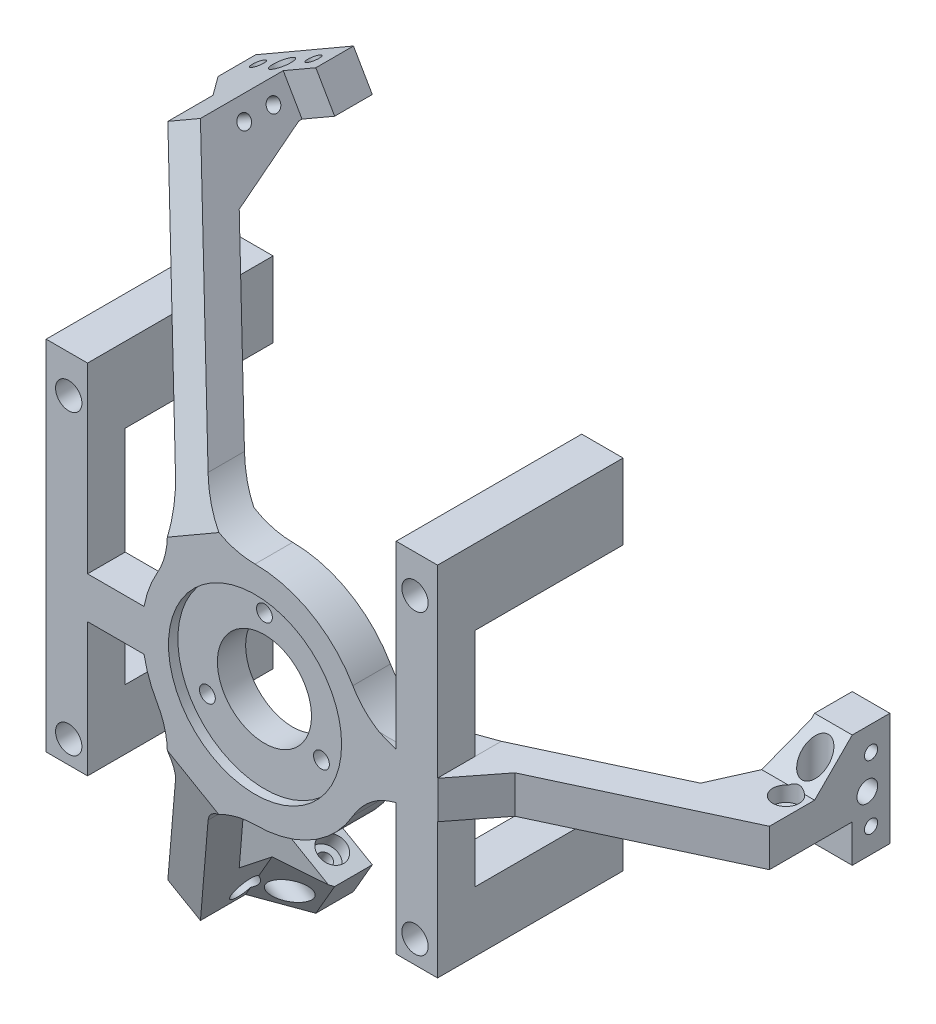
from build123d import *
from OCP.BRepFilletAPI import BRepFilletAPI_MakeChamfer

# Parameters (mm, degrees)
ESQUISSE1_W                    = 10
ESQUISSE1_H                    = 30
BOSS_EXTRU_1_DEPTH             = 10
BOSS_EXTRU_1_2_DEPTH           = 10
BOSS_EXTRU_1_3_DEPTH           = 10
ESQUISSE2_W                    = 10
ESQUISSE2_H                    = 10
BOSS_EXTRU_2_DEPTH             = 45
BOSS_EXTRU_3_DEPTH             = 10
CHANFREIN1_SIZE                = 28
CHANFREIN1_SIZE2               = 60.046193774
CHANFREIN2_SIZE                = 33
CHANFREIN2_SIZE2               = 70.768728377
CONG_1_R                       = 20
CHANFREIN3_SIZE                = 10
CHANFREIN3_SIZE2               = 16.129823564
ENL_V_MAT_EXTRU_1_REACH        = 158.32
ESQUISSE4_R                    = 12.5
ESQUISSE5_R                    = 23
ENL_V_MAT_EXTRU_2_DEPTH        = 2.5
ENL_V_MAT_EXTRU_3_REACH        = 157.297
ESQUISSE6_R                    = 2.1
ESQUISSE7_W                    = 11
ESQUISSE7_H                    = 95
BOSS_EXTRU_4_DEPTH             = 39.3
BOSS_EXTRU_4_DIRECTION_2_REACH = 154.434
ENL_V_MAT_EXTRU_4_REACH        = 152.471
ESQUISSE8_R                    = 1.75
ESQUISSE9_R                    = 3.5
ENL_V_MAT_EXTRU_5_DEPTH        = 28.3
ESQUISSE10_W                   = 26.008475794
ESQUISSE10_H                   = 59
ESQUISSE10_W_2                 = 11
ENL_V_MAT_EXTRU_6_DEPTH        = 39.3
BOSS_EXTRU_5_REACH             = 154.434
BOSS_EXTRU_6_REACH             = 153.518
CHANFREIN5_SIZE                = 10
CHANFREIN5_SIZE_2              = 7.374028065
ENL_V_MAT_EXTRU_7_REACH        = 157.079
ESQUISSE11_R                   = 1.75
ESQUISSE12_R                   = 3.5
ENL_V_MAT_EXTRU_8_DEPTH        = 4
ENL_V_MAT_EXTRU_9_REACH        = 244.289
ESQUISSE13_R                   = 1.75
ESQUISSE14_R                   = 3.5
ENL_V_MAT_EXTRU_10_DEPTH       = 4
ENL_V_MAT_EXTRU_11_REACH       = 244.289
ESQUISSE15_R                   = 2.75
R_P_TITION_CIRCULAIRE1_COUNT   = 3
CHANFREIN4_SIZE                = 10


with BuildPart() as part:
    # Esquisse1 → Boss.-Extru.1 (new body)
    with BuildSketch(Plane.XY):
        with Locations((98.67, 0)):
            Rectangle(ESQUISSE1_W, ESQUISSE1_H)
    extrude(amount=BOSS_EXTRU_1_DEPTH)



with BuildPart() as body_2:
    # Esquisse1 → Boss.-Extru.1 2 (new body)
    with BuildSketch(Plane.XY):
        Polygon((-33.844618943, -88.620599572), (-59.825381057, -73.620599572), (-64.825381057, -82.28085361), (-38.844618943, -97.28085361), align=None)
    extrude(amount=BOSS_EXTRU_1_2_DEPTH)


with BuildPart() as body_3:
    # Esquisse1 → Boss.-Extru.1 3 (new body)
    with BuildSketch(Plane.XY):
        Polygon((-59.825381057, 73.620599572), (-33.844618943, 88.620599572), (-38.844618943, 97.28085361), (-64.825381057, 82.28085361), align=None)
    extrude(amount=BOSS_EXTRU_1_3_DEPTH)


with BuildPart() as part_1:
    add(part.part)

    add(body_2.part)  # Boss.-Extru.2 merges body 2

    add(body_3.part)  # Boss.-Extru.2 merges body 3
    # Esquisse2 → Boss.-Extru.2 (add)
    with BuildSketch(Plane.XY.offset(10)):
        Polygon((-47.504872981, 92.28085361), (-56.165127019, 87.28085361), (-51.165127019, 78.620599572), (-42.504872981, 83.620599572), align=None)
        with Locations((98.67, 0)):
            Rectangle(ESQUISSE2_W, ESQUISSE2_H)
        Polygon((-42.504872981, -83.620599572), (-51.165127019, -78.620599572), (-56.165127019, -87.28085361), (-47.504872981, -92.28085361), align=None)
    extrude(amount=BOSS_EXTRU_2_DEPTH)

    # Esquisse3 → Boss.-Extru.3 (add)
    with BuildSketch(Plane.XY.offset(55)):
        with BuildLine():
            Line((103.67, 5), (103.67, -5))
            Line((103.67, -5), (29.580398915, -5))
            ThreePointArc((29.580398915, -5), (15, -25.980762114), (-10.460072439, -28.117376915))
            Line((-10.460072439, -28.117376915), (-47.504872981, -92.28085361))
            Line((-47.504872981, -92.28085361), (-56.165127019, -87.28085361))
            Line((-56.165127019, -87.28085361), (-19.120326477, -23.117376915))
            ThreePointArc((-19.120326477, -23.117376915), (-30, 0), (-19.120326477, 23.117376915))
            Line((-19.120326477, 23.117376915), (-56.165127019, 87.28085361))
            Line((-56.165127019, 87.28085361), (-47.504872981, 92.28085361))
            Line((-47.504872981, 92.28085361), (-10.460072439, 28.117376915))
            ThreePointArc((-10.460072439, 28.117376915), (15, 25.980762114), (29.580398915, 5))
            Line((29.580398915, 5), (103.67, 5))
        make_face()
    extrude(amount=BOSS_EXTRU_3_DEPTH)

    # Chanfrein1: one chamfer whose edges measure the first distance from different faces: ONE call of the kernel's chamfer builder (chamfer() names one face for all edges)
    chanfrein1_edges_1 = [part_1.edges().sort_by_distance(p)[0] for p in [
        (93.67, 0, 55),
    ]]
    chanfrein1_side_1 = [part_1.faces().sort_by_distance(p)[0] for p in [
        (93.67, 0, 21.5),
    ]]
    chanfrein1_edges_2 = [part_1.edges().sort_by_distance(p)[0] for p in [
        (-46.835, -81.120599572, 55),
    ]]
    chanfrein1_side_2 = [part_1.faces().sort_by_distance(p)[0] for p in [
        (-46.835, -81.120599572, 21.5),
    ]]
    chanfrein1_edges_3 = [part_1.edges().sort_by_distance(p)[0] for p in [
        (-46.835, 81.120599572, 55),
    ]]
    chanfrein1_side_3 = [part_1.faces().sort_by_distance(p)[0] for p in [
        (-46.835, 81.120599572, 21.5),
    ]]
    chanfrein1 = BRepFilletAPI_MakeChamfer(part_1.part.solid().wrapped)
    for e in chanfrein1_edges_1:
        chanfrein1.Add(CHANFREIN1_SIZE, CHANFREIN1_SIZE2, e.wrapped, chanfrein1_side_1[0].wrapped)  # the first distance lies on this face
    for e in chanfrein1_edges_2:
        chanfrein1.Add(CHANFREIN1_SIZE, CHANFREIN1_SIZE2, e.wrapped, chanfrein1_side_2[0].wrapped)  # the first distance lies on this face
    for e in chanfrein1_edges_3:
        chanfrein1.Add(CHANFREIN1_SIZE, CHANFREIN1_SIZE2, e.wrapped, chanfrein1_side_3[0].wrapped)  # the first distance lies on this face
    add(Compound.cast(chanfrein1.Shape()), mode=Mode.REPLACE)

    # Chanfrein2: one chamfer whose edges measure the first distance from different faces: ONE call of the kernel's chamfer builder (chamfer() names one face for all edges)
    chanfrein2_edges_1 = [part_1.edges().sort_by_distance(p)[0] for p in [
        (-51.835, 89.78085361, 65),
    ]]
    chanfrein2_side_1 = [part_1.faces().sort_by_distance(p)[0] for p in [
        (-51.835, 89.78085361, 26.029411765),
    ]]
    chanfrein2_edges_2 = [part_1.edges().sort_by_distance(p)[0] for p in [
        (-51.835, -89.78085361, 65),
    ]]
    chanfrein2_side_2 = [part_1.faces().sort_by_distance(p)[0] for p in [
        (-51.835, -89.78085361, 26.029411765),
    ]]
    chanfrein2_edges_3 = [part_1.edges().sort_by_distance(p)[0] for p in [
        (103.67, 0, 65),
    ]]
    chanfrein2_side_3 = [part_1.faces().sort_by_distance(p)[0] for p in [
        (103.67, 0, 26.029411765),
    ]]
    chanfrein2 = BRepFilletAPI_MakeChamfer(part_1.part.solid().wrapped)
    for e in chanfrein2_edges_1:
        chanfrein2.Add(CHANFREIN2_SIZE, CHANFREIN2_SIZE2, e.wrapped, chanfrein2_side_1[0].wrapped)  # the first distance lies on this face
    for e in chanfrein2_edges_2:
        chanfrein2.Add(CHANFREIN2_SIZE, CHANFREIN2_SIZE2, e.wrapped, chanfrein2_side_2[0].wrapped)  # the first distance lies on this face
    for e in chanfrein2_edges_3:
        chanfrein2.Add(CHANFREIN2_SIZE, CHANFREIN2_SIZE2, e.wrapped, chanfrein2_side_3[0].wrapped)  # the first distance lies on this face
    add(Compound.cast(chanfrein2.Shape()), mode=Mode.REPLACE)

    # Congé1
    # the kernel refuses this fillet: 20 mm, written as the material it adds along each edge
    with BuildSketch(Plane(origin=(29.580398915, -5, 55), x_dir=(1, 0, 0), z_dir=(0, 0, 1))) as cong_1_piece_1_section:
        with BuildLine():
            CenterArc((13.720871274, -20), CONG_1_R, 90, 60)
            ThreePointArc((-3.599636802, -10), (-1.353449847, -5.160676467), (0, 0))
            Line((0, 0), (13.720871274, 0))
        make_face()
    cong_1_piece_1 = extrude(amount=10, mode=Mode.PRIVATE)
    cong_1_piece_1 = split(cong_1_piece_1, bisect_by=Plane(origin=(29.686956687, -8.874488786, 56.835783089), z_dir=(-0.42261826174069717, 0, -0.9063077870366512)), keep=Keep.TOP, mode=Mode.PRIVATE)
    add(cong_1_piece_1)
    with BuildSketch(Plane(origin=(29.580398915, -5, 20.697821816), x_dir=(1, 0, 0), z_dir=(0, 0, 1))) as cong_1_piece_2_section:
        with BuildLine():
            CenterArc((13.720871274, -20), CONG_1_R, 90, 60)
            ThreePointArc((-3.599636802, -10), (-1.353449847, -5.160676467), (0, 0))
            Line((0, 0), (13.720871274, 0))
        make_face()
    cong_1_piece_2 = extrude(amount=44.302178184, mode=Mode.PRIVATE)
    cong_1_piece_2 = split(cong_1_piece_2, bisect_by=Plane(origin=(38.771114589, -5.14420789, 55), z_dir=(0, 0, -1)), keep=Keep.TOP, mode=Mode.PRIVATE)
    cong_1_piece_2 = split(cong_1_piece_2, bisect_by=Plane(origin=(38.311444008, -5.14420789, 52.814118603), z_dir=(0.42261826174069717, 0, 0.9063077870366512)), keep=Keep.TOP, mode=Mode.PRIVATE)
    add(cong_1_piece_2)
    with BuildSketch(Plane(origin=(29.580398915, -5, 55), x_dir=(1, 0, 0), z_dir=(0, 0, 1))) as cong_1_piece_3_section:
        with BuildLine():
            CenterArc((13.720871274, -20), CONG_1_R, 90, 60)
            ThreePointArc((-3.599636802, -10), (-1.353449847, -5.160676467), (0, 0))
            Line((0, 0), (13.720871274, 0))
        make_face()
    cong_1_piece_3 = extrude(amount=10, mode=Mode.PRIVATE)
    cong_1_piece_3 = split(cong_1_piece_3, bisect_by=Plane(origin=(34.156961746, -7.089474208, 64.41446208), z_dir=(-0.42261826174069717, 0, -0.906307787036651)), keep=Keep.TOP, mode=Mode.PRIVATE)
    cong_1_piece_3 = split(cong_1_piece_3, bisect_by=Plane(origin=(30.455788686, -7.089474208, 56.47727084), z_dir=(0.42261826174069717, 0, 0.9063077870366512)), keep=Keep.TOP, mode=Mode.PRIVATE)
    add(cong_1_piece_3)
    with BuildSketch(Plane(origin=(-10.460072439, -28.117376915, 20.697821816), x_dir=(0.984186439950099, -0.17713568646196043, 0), z_dir=(0, 0, 1))) as cong_1_piece_4_section:
        with BuildLine():
            CenterArc((14.170854917, -19.683728799), CONG_1_R, 100.202965887, 60)
            Line((-4.647111129, -12.909944487), (0, 0))
            ThreePointArc((0, 0), (5.314070594, -0.474406801), (10.628141188, 0))
        make_face()
    cong_1_piece_4 = extrude(amount=44.302178184, mode=Mode.PRIVATE)
    cong_1_piece_4 = split(cong_1_piece_4, bisect_by=Plane(origin=(-14.930542581, -36.148874113, 55), z_dir=(0, 0, -1)), keep=Keep.TOP, mode=Mode.PRIVATE)
    cong_1_piece_4 = split(cong_1_piece_4, bisect_by=Plane(origin=(-14.700707291, -35.750787713, 52.814118603), z_dir=(-0.21130913087034803, -0.3659981507706655, 0.906307787036651)), keep=Keep.TOP, mode=Mode.PRIVATE)
    add(cong_1_piece_4)
    with BuildSketch(Plane(origin=(-10.460072439, -28.117376915, 55), x_dir=(0.9841864399500992, -0.17713568646195998, 0), z_dir=(0, 0, 1))) as cong_1_piece_5_section:
        with BuildLine():
            CenterArc((14.170854917, -19.683728799), CONG_1_R, 100.202965887, 60)
            Line((-4.647111129, -12.909944487), (0, 0))
            ThreePointArc((0, 0), (5.314070594, -0.474406801), (10.628141188, 0))
        make_face()
    cong_1_piece_5 = extrude(amount=10, mode=Mode.PRIVATE)
    cong_1_piece_5 = split(cong_1_piece_5, bisect_by=Plane(origin=(-7.157945608, -30.146903047, 56.835783088), z_dir=(0.21130913087034803, 0.3659981507706655, -0.906307787036651)), keep=Keep.TOP, mode=Mode.PRIVATE)
    add(cong_1_piece_5)
    with BuildSketch(Plane(origin=(-10.460072439, -28.117376915, 55), x_dir=(0.9841864399500992, -0.17713568646195998, 0), z_dir=(0, 0, 1))) as cong_1_piece_6_section:
        with BuildLine():
            CenterArc((14.170854917, -19.683728799), CONG_1_R, 100.202965887, 60)
            Line((-4.647111129, -12.909944487), (0, 0))
            ThreePointArc((0, 0), (5.314070594, -0.474406801), (10.628141188, 0))
        make_face()
    cong_1_piece_6 = extrude(amount=10, mode=Mode.PRIVATE)
    cong_1_piece_6 = split(cong_1_piece_6, bisect_by=Plane(origin=(-10.938816109, -33.125533693, 64.414462079), z_dir=(0.21130913087034933, 0.3659981507706645, -0.906307787036651)), keep=Keep.TOP, mode=Mode.PRIVATE)
    cong_1_piece_6 = split(cong_1_piece_6, bisect_by=Plane(origin=(-9.088229579, -29.9202238, 56.477270839), z_dir=(-0.21130913087034803, -0.3659981507706655, 0.906307787036651)), keep=Keep.TOP, mode=Mode.PRIVATE)
    add(cong_1_piece_6)
    with BuildSketch(Plane(origin=(-19.120326477, -23.117376915, 20.697821816), x_dir=(-0.6454972243679025, 0.7637626158259736, 0), z_dir=(0, 0, 1))) as cong_1_piece_7_section:
        with BuildLine():
            CenterArc((14.170854917, 19.683728799), CONG_1_R, 199.797034113, 60)
            Line((-4.647111129, 12.909944487), (0, 0))
            ThreePointArc((0, 0), (5.314070594, 0.474406801), (10.628141188, 0))
        make_face()
    cong_1_piece_7 = extrude(amount=44.302178184, mode=Mode.PRIVATE)
    cong_1_piece_7 = split(cong_1_piece_7, bisect_by=Plane(origin=(-23.84057201, -31.004666224, 55), z_dir=(0, 0, -1)), keep=Keep.TOP, mode=Mode.PRIVATE)
    cong_1_piece_7 = split(cong_1_piece_7, bisect_by=Plane(origin=(-23.610736719, -30.606579824, 52.814118603), z_dir=(-0.21130913087034803, -0.3659981507706655, 0.906307787036651)), keep=Keep.TOP, mode=Mode.PRIVATE)
    add(cong_1_piece_7)
    with BuildSketch(Plane(origin=(-19.120326477, -23.117376915, 55), x_dir=(-0.6454972243679029, 0.7637626158259734, 0), z_dir=(0, 0, 1))) as cong_1_piece_8_section:
        with BuildLine():
            CenterArc((14.170854917, 19.683728799), CONG_1_R, 199.797034113, 60)
            Line((-4.647111129, 12.909944487), (0, 0))
            ThreePointArc((0, 0), (5.314070594, 0.474406801), (10.628141188, 0))
        make_face()
    cong_1_piece_8 = extrude(amount=10, mode=Mode.PRIVATE)
    cong_1_piece_8 = split(cong_1_piece_8, bisect_by=Plane(origin=(-22.529011081, -21.272414259, 56.835783088), z_dir=(0.21130913087034803, 0.3659981507706655, -0.906307787036651)), keep=Keep.TOP, mode=Mode.PRIVATE)
    add(cong_1_piece_8)
    with BuildSketch(Plane(origin=(-19.120326477, -23.117376915, 55), x_dir=(-0.6454972243679029, 0.7637626158259734, 0), z_dir=(0, 0, 1))) as cong_1_piece_9_section:
        with BuildLine():
            CenterArc((14.170854917, 19.683728799), CONG_1_R, 199.797034113, 60)
            Line((-4.647111129, 12.909944487), (0, 0))
            ThreePointArc((0, 0), (5.314070594, 0.474406801), (10.628141188, 0))
        make_face()
    cong_1_piece_9 = extrude(amount=10, mode=Mode.PRIVATE)
    cong_1_piece_9 = split(cong_1_piece_9, bisect_by=Plane(origin=(-23.218145637, -26.036059484, 64.414462079), z_dir=(0.21130913087034933, 0.3659981507706645, -0.906307787036651)), keep=Keep.TOP, mode=Mode.PRIVATE)
    cong_1_piece_9 = split(cong_1_piece_9, bisect_by=Plane(origin=(-21.367559108, -22.830749591, 56.477270839), z_dir=(-0.21130913087034803, -0.3659981507706655, 0.906307787036651)), keep=Keep.TOP, mode=Mode.PRIVATE)
    add(cong_1_piece_9)
    with BuildSketch(Plane(origin=(-19.120326477, 23.117376915, 55), x_dir=(-0.4999999999999981, 0.8660254037844398, 0), z_dir=(0, 0, 1))) as cong_1_piece_10_section:
        with BuildLine():
            CenterArc((13.720871274, 20), CONG_1_R, 210, 60)
            ThreePointArc((-3.599636802, 10), (-1.353449847, 5.160676467), (0, 0))
            Line((0, 0), (13.720871274, 0))
        make_face()
    cong_1_piece_10 = extrude(amount=10, mode=Mode.PRIVATE)
    cong_1_piece_10 = split(cong_1_piece_10, bisect_by=Plane(origin=(-22.529011078, 21.272414259, 56.835783089), z_dir=(0.21130913087034867, -0.36599815077066483, -0.906307787036651)), keep=Keep.TOP, mode=Mode.PRIVATE)
    add(cong_1_piece_10)
    with BuildSketch(Plane(origin=(-19.120326477, 23.117376915, 20.697821816), x_dir=(-0.5000000000000007, 0.8660254037844383, 0), z_dir=(0, 0, 1))) as cong_1_piece_11_section:
        with BuildLine():
            CenterArc((13.720871274, 20), CONG_1_R, 210, 60)
            ThreePointArc((-3.599636802, 10), (-1.353449847, 5.160676467), (0, 0))
            Line((0, 0), (13.720871274, 0))
        make_face()
    cong_1_piece_11 = extrude(amount=44.302178184, mode=Mode.PRIVATE)
    cong_1_piece_11 = split(cong_1_piece_11, bisect_by=Plane(origin=(-23.84057201, 31.004666222, 55), z_dir=(0, 0, -1)), keep=Keep.TOP, mode=Mode.PRIVATE)
    cong_1_piece_11 = split(cong_1_piece_11, bisect_by=Plane(origin=(-23.610736719, 30.606579822, 52.814118603), z_dir=(-0.21130913087034867, 0.36599815077066483, 0.906307787036651)), keep=Keep.TOP, mode=Mode.PRIVATE)
    add(cong_1_piece_11)
    with BuildSketch(Plane(origin=(-19.120326477, 23.117376915, 55), x_dir=(-0.4999999999999981, 0.8660254037844398, 0), z_dir=(0, 0, 1))) as cong_1_piece_12_section:
        with BuildLine():
            CenterArc((13.720871274, 20), CONG_1_R, 210, 60)
            ThreePointArc((-3.599636802, 10), (-1.353449847, 5.160676467), (0, 0))
            Line((0, 0), (13.720871274, 0))
        make_face()
    cong_1_piece_12 = extrude(amount=10, mode=Mode.PRIVATE)
    cong_1_piece_12 = split(cong_1_piece_12, bisect_by=Plane(origin=(-23.218145636, 26.036059484, 64.41446208), z_dir=(0.2113091308703489, -0.36599815077066467, -0.906307787036651)), keep=Keep.TOP, mode=Mode.PRIVATE)
    cong_1_piece_12 = split(cong_1_piece_12, bisect_by=Plane(origin=(-21.367559107, 22.830749591, 56.47727084), z_dir=(-0.21130913087034867, 0.36599815077066483, 0.906307787036651)), keep=Keep.TOP, mode=Mode.PRIVATE)
    add(cong_1_piece_12)
    with BuildSketch(Plane(origin=(29.580398915, 5, 55), x_dir=(1, 0, 0), z_dir=(0, 0, 1))) as cong_1_piece_13_section:
        with BuildLine():
            CenterArc((13.720871274, 20), CONG_1_R, 210, 60)
            ThreePointArc((-3.599636802, 10), (-1.353449847, 5.160676467), (0, 0))
            Line((0, 0), (13.720871274, 0))
        make_face()
    cong_1_piece_13 = extrude(amount=10, mode=Mode.PRIVATE)
    cong_1_piece_13 = split(cong_1_piece_13, bisect_by=Plane(origin=(29.686956687, 8.874488786, 56.835783089), z_dir=(-0.42261826174069717, 0, -0.9063077870366512)), keep=Keep.TOP, mode=Mode.PRIVATE)
    add(cong_1_piece_13)
    with BuildSketch(Plane(origin=(29.580398915, 5, 20.697821816), x_dir=(1, 0, 0), z_dir=(0, 0, 1))) as cong_1_piece_14_section:
        with BuildLine():
            CenterArc((13.720871274, 20), CONG_1_R, 210, 60)
            ThreePointArc((-3.599636802, 10), (-1.353449847, 5.160676467), (0, 0))
            Line((0, 0), (13.720871274, 0))
        make_face()
    cong_1_piece_14 = extrude(amount=44.302178184, mode=Mode.PRIVATE)
    cong_1_piece_14 = split(cong_1_piece_14, bisect_by=Plane(origin=(38.771114589, 5.14420789, 55), z_dir=(0, 0, -1)), keep=Keep.TOP, mode=Mode.PRIVATE)
    cong_1_piece_14 = split(cong_1_piece_14, bisect_by=Plane(origin=(38.311444008, 5.14420789, 52.814118603), z_dir=(0.42261826174069717, 0, 0.9063077870366512)), keep=Keep.TOP, mode=Mode.PRIVATE)
    add(cong_1_piece_14)
    with BuildSketch(Plane(origin=(29.580398915, 5, 55), x_dir=(1, 0, 0), z_dir=(0, 0, 1))) as cong_1_piece_15_section:
        with BuildLine():
            CenterArc((13.720871274, 20), CONG_1_R, 210, 60)
            ThreePointArc((-3.599636802, 10), (-1.353449847, 5.160676467), (0, 0))
            Line((0, 0), (13.720871274, 0))
        make_face()
    cong_1_piece_15 = extrude(amount=10, mode=Mode.PRIVATE)
    cong_1_piece_15 = split(cong_1_piece_15, bisect_by=Plane(origin=(34.156961746, 7.089474208, 64.41446208), z_dir=(-0.42261826174069717, 0, -0.906307787036651)), keep=Keep.TOP, mode=Mode.PRIVATE)
    cong_1_piece_15 = split(cong_1_piece_15, bisect_by=Plane(origin=(30.455788686, 7.089474208, 56.47727084), z_dir=(0.42261826174069717, 0, 0.9063077870366512)), keep=Keep.TOP, mode=Mode.PRIVATE)
    add(cong_1_piece_15)
    with BuildSketch(Plane(origin=(-10.460072439, 28.117376915, 20.697821816), x_dir=(0.9841864399500989, 0.17713568646196104, 0), z_dir=(0, 0, 1))) as cong_1_piece_16_section:
        with BuildLine():
            CenterArc((14.170854917, 19.683728799), CONG_1_R, 199.797034113, 60)
            Line((-4.647111129, 12.909944487), (0, 0))
            ThreePointArc((0, 0), (5.314070594, 0.474406801), (10.628141188, 0))
        make_face()
    cong_1_piece_16 = extrude(amount=44.302178184, mode=Mode.PRIVATE)
    cong_1_piece_16 = split(cong_1_piece_16, bisect_by=Plane(origin=(-14.930542581, 36.148874113, 55), z_dir=(0, 0, -1)), keep=Keep.TOP, mode=Mode.PRIVATE)
    cong_1_piece_16 = split(cong_1_piece_16, bisect_by=Plane(origin=(-14.700707291, 35.750787713, 52.814118603), z_dir=(-0.21130913087034867, 0.36599815077066483, 0.906307787036651)), keep=Keep.TOP, mode=Mode.PRIVATE)
    add(cong_1_piece_16)
    with BuildSketch(Plane(origin=(-10.460072439, 28.117376915, 55), x_dir=(0.9841864399500989, 0.1771356864619613, 0), z_dir=(0, 0, 1))) as cong_1_piece_17_section:
        with BuildLine():
            CenterArc((14.170854917, 19.683728799), CONG_1_R, 199.797034113, 60)
            Line((-4.647111129, 12.909944487), (0, 0))
            ThreePointArc((0, 0), (5.314070594, 0.474406801), (10.628141188, 0))
        make_face()
    cong_1_piece_17 = extrude(amount=10, mode=Mode.PRIVATE)
    cong_1_piece_17 = split(cong_1_piece_17, bisect_by=Plane(origin=(-7.157945608, 30.146903047, 56.835783088), z_dir=(0.21130913087034867, -0.36599815077066483, -0.906307787036651)), keep=Keep.TOP, mode=Mode.PRIVATE)
    add(cong_1_piece_17)
    with BuildSketch(Plane(origin=(-10.460072439, 28.117376915, 55), x_dir=(0.9841864399500989, 0.1771356864619613, 0), z_dir=(0, 0, 1))) as cong_1_piece_18_section:
        with BuildLine():
            CenterArc((14.170854917, 19.683728799), CONG_1_R, 199.797034113, 60)
            Line((-4.647111129, 12.909944487), (0, 0))
            ThreePointArc((0, 0), (5.314070594, 0.474406801), (10.628141188, 0))
        make_face()
    cong_1_piece_18 = extrude(amount=10, mode=Mode.PRIVATE)
    cong_1_piece_18 = split(cong_1_piece_18, bisect_by=Plane(origin=(-10.938816109, 33.125533693, 64.414462079), z_dir=(0.2113091308703489, -0.36599815077066467, -0.906307787036651)), keep=Keep.TOP, mode=Mode.PRIVATE)
    cong_1_piece_18 = split(cong_1_piece_18, bisect_by=Plane(origin=(-9.088229579, 29.9202238, 56.477270839), z_dir=(-0.21130913087034867, 0.36599815077066483, 0.906307787036651)), keep=Keep.TOP, mode=Mode.PRIVATE)
    add(cong_1_piece_18)

    # Chanfrein3: one chamfer whose edges measure the first distance from different faces: ONE call of the kernel's chamfer builder (chamfer() names one face for all edges)
    chanfrein3_edges_1 = [part_1.edges().sort_by_distance(p)[0] for p in [
        (93.67, 0, 27),
    ]]
    chanfrein3_side_1 = [part_1.faces().sort_by_distance(p)[0] for p in [
        (62.943360547, 0, 41.328067286),
    ]]
    chanfrein3_edges_2 = [part_1.edges().sort_by_distance(p)[0] for p in [
        (-46.835, -81.120599572, 27),
    ]]
    chanfrein3_side_2 = [part_1.faces().sort_by_distance(p)[0] for p in [
        (-31.471680274, -54.510549234, 41.328067286),
    ]]
    chanfrein3_edges_3 = [part_1.edges().sort_by_distance(p)[0] for p in [
        (-46.835, 81.120599572, 27),
    ]]
    chanfrein3_side_3 = [part_1.faces().sort_by_distance(p)[0] for p in [
        (-31.471680274, 54.510549234, 41.328067286),
    ]]
    chanfrein3 = BRepFilletAPI_MakeChamfer(part_1.part.solid().wrapped)
    for e in chanfrein3_edges_1:
        chanfrein3.Add(CHANFREIN3_SIZE, CHANFREIN3_SIZE2, e.wrapped, chanfrein3_side_1[0].wrapped)  # the first distance lies on this face
    for e in chanfrein3_edges_2:
        chanfrein3.Add(CHANFREIN3_SIZE, CHANFREIN3_SIZE2, e.wrapped, chanfrein3_side_2[0].wrapped)  # the first distance lies on this face
    for e in chanfrein3_edges_3:
        chanfrein3.Add(CHANFREIN3_SIZE, CHANFREIN3_SIZE2, e.wrapped, chanfrein3_side_3[0].wrapped)  # the first distance lies on this face
    add(Compound.cast(chanfrein3.Shape()), mode=Mode.REPLACE)

    # Esquisse4 → Enlèv. mat.-Extru.1 (cut, up to next)
    with BuildSketch(Plane.XY.offset(65), mode=Mode.PRIVATE) as enl_v_mat_extru_1_sk1:
        Circle(ESQUISSE4_R)
    enl_v_mat_extru_1_tool1 = extrude(enl_v_mat_extru_1_sk1.sketch, amount=-ENL_V_MAT_EXTRU_1_REACH, mode=Mode.PRIVATE) & part_1.part
    add(enl_v_mat_extru_1_tool1.solids().sort_by_distance((0, 0, 65))[0], mode=Mode.SUBTRACT)

    # Esquisse5 → Enlèv. mat.-Extru.2 (cut)
    with BuildSketch(Plane.XY.offset(65)):
        Circle(ESQUISSE5_R)
    extrude(amount=-ENL_V_MAT_EXTRU_2_DEPTH, mode=Mode.SUBTRACT)

    # Esquisse6 → Enlèv. mat.-Extru.3 (cut, up to next)
    with BuildSketch(Plane.XY.offset(62.5), mode=Mode.PRIVATE) as enl_v_mat_extru_3_sk1:
        with Locations((0, 17.5)):
            Circle(ESQUISSE6_R)
    enl_v_mat_extru_3_tool1 = extrude(enl_v_mat_extru_3_sk1.sketch, amount=-ENL_V_MAT_EXTRU_3_REACH, mode=Mode.PRIVATE) & part_1.part
    # Esquisse6 → Enlèv. mat.-Extru.3 (cut, up to next)
    with BuildSketch(Plane.XY.offset(62.5), mode=Mode.PRIVATE) as enl_v_mat_extru_3_sk2:
        with Locations((15.155444566, -8.75)):
            Circle(ESQUISSE6_R)
    enl_v_mat_extru_3_tool2 = extrude(enl_v_mat_extru_3_sk2.sketch, amount=-ENL_V_MAT_EXTRU_3_REACH, mode=Mode.PRIVATE) & part_1.part
    # Esquisse6 → Enlèv. mat.-Extru.3 (cut, up to next)
    with BuildSketch(Plane.XY.offset(62.5), mode=Mode.PRIVATE) as enl_v_mat_extru_3_sk3:
        with Locations((-15.155444566, -8.75)):
            Circle(ESQUISSE6_R)
    enl_v_mat_extru_3_tool3 = extrude(enl_v_mat_extru_3_sk3.sketch, amount=-ENL_V_MAT_EXTRU_3_REACH, mode=Mode.PRIVATE) & part_1.part
    add(enl_v_mat_extru_3_tool1.solids().sort_by_distance((0, 17.5, 62.5))[0], mode=Mode.SUBTRACT)
    add(enl_v_mat_extru_3_tool2.solids().sort_by_distance((15.155445, -8.75, 62.5))[0], mode=Mode.SUBTRACT)
    add(enl_v_mat_extru_3_tool3.solids().sort_by_distance((-15.155445, -8.75, 62.5))[0], mode=Mode.SUBTRACT)

    # Esquisse7 → Boss.-Extru.4 (add)
    with BuildSketch(Plane(origin=(0, 0, 55), x_dir=(-1, 0, 0), z_dir=(0, 0, -1))):
        with Locations((-43, 6.5)):
            Rectangle(ESQUISSE7_W, ESQUISSE7_H)
        with BuildLine():
            Line((55.5, -41), (44.5, -41))
            Line((44.5, -41), (44.5, -5.5))
            Line((44.5, -5.5), (29.491524206, -5.5))
            ThreePointArc((29.491524206, -5.5), (30, 0), (29.491524206, 5.5))
            Line((29.491524206, 5.5), (44.5, 5.5))
            Line((44.5, 5.5), (44.5, 54))
            Line((44.5, 54), (55.5, 54))
            Line((55.5, 54), (55.5, -41))
        make_face()
    extrude(amount=BOSS_EXTRU_4_DEPTH)

    # Boss.-Extru.4 direction 2: up to this face of the body (flat: up to its plane)
    boss_extru_4_direction_2_end = Plane(part_1.part.faces().sort_by_distance((-10.405638932, 30.939769239, 65))[0])
    # Esquisse7 → Boss.-Extru.4 direction 2 (add, up to the picked face)
    with BuildSketch(Plane(origin=(0, 0, 55), x_dir=(-1, 0, 0), z_dir=(0, 0, -1)), mode=Mode.PRIVATE) as boss_extru_4_direction_2_sk1:
        with Locations((-43, 6.5)):
            Rectangle(ESQUISSE7_W, ESQUISSE7_H)
    boss_extru_4_direction_2_tool1 = split(extrude(boss_extru_4_direction_2_sk1.sketch, amount=-BOSS_EXTRU_4_DIRECTION_2_REACH, mode=Mode.PRIVATE), bisect_by=boss_extru_4_direction_2_end, keep=Keep.BOTH, mode=Mode.PRIVATE)
    # Esquisse7 → Boss.-Extru.4 direction 2 (add, up to the picked face)
    with BuildSketch(Plane(origin=(0, 0, 55), x_dir=(-1, 0, 0), z_dir=(0, 0, -1)), mode=Mode.PRIVATE) as boss_extru_4_direction_2_sk2:
        with BuildLine():
            Line((55.5, -41), (44.5, -41))
            Line((44.5, -41), (44.5, -5.5))
            Line((44.5, -5.5), (29.491524206, -5.5))
            ThreePointArc((29.491524206, -5.5), (30, 0), (29.491524206, 5.5))
            Line((29.491524206, 5.5), (44.5, 5.5))
            Line((44.5, 5.5), (44.5, 54))
            Line((44.5, 54), (55.5, 54))
            Line((55.5, 54), (55.5, -41))
        make_face()
    boss_extru_4_direction_2_tool2 = split(extrude(boss_extru_4_direction_2_sk2.sketch, amount=-BOSS_EXTRU_4_DIRECTION_2_REACH, mode=Mode.PRIVATE), bisect_by=boss_extru_4_direction_2_end, keep=Keep.BOTH, mode=Mode.PRIVATE)
    add(boss_extru_4_direction_2_tool1.solids().sort_by(Axis((43, 6.5, 55), (0, 0, 1)))[0])
    add(boss_extru_4_direction_2_tool2.solids().sort_by(Axis((-48.283205, 5.630584, 55), (0, 0, 1)))[0])

    # Esquisse8 → Enlèv. mat.-Extru.4 (cut, up to next)
    with BuildSketch(Plane(origin=(0, 0, 15.7), x_dir=(-1, 0, 0), z_dir=(0, 0, -1)), mode=Mode.PRIVATE) as enl_v_mat_extru_4_sk1:
        with Locations((49.5, 44)):
            Circle(ESQUISSE8_R)
    enl_v_mat_extru_4_tool1 = extrude(enl_v_mat_extru_4_sk1.sketch, amount=-ENL_V_MAT_EXTRU_4_REACH, mode=Mode.PRIVATE) & part_1.part
    # Esquisse8 → Enlèv. mat.-Extru.4 (cut, up to next)
    with BuildSketch(Plane(origin=(0, 0, 15.7), x_dir=(-1, 0, 0), z_dir=(0, 0, -1)), mode=Mode.PRIVATE) as enl_v_mat_extru_4_sk2:
        with Locations((-42.5, 44)):
            Circle(ESQUISSE8_R)
    enl_v_mat_extru_4_tool2 = extrude(enl_v_mat_extru_4_sk2.sketch, amount=-ENL_V_MAT_EXTRU_4_REACH, mode=Mode.PRIVATE) & part_1.part
    # Esquisse8 → Enlèv. mat.-Extru.4 (cut, up to next)
    with BuildSketch(Plane(origin=(0, 0, 15.7), x_dir=(-1, 0, 0), z_dir=(0, 0, -1)), mode=Mode.PRIVATE) as enl_v_mat_extru_4_sk3:
        with Locations((-42.5, -35)):
            Circle(ESQUISSE8_R)
    enl_v_mat_extru_4_tool3 = extrude(enl_v_mat_extru_4_sk3.sketch, amount=-ENL_V_MAT_EXTRU_4_REACH, mode=Mode.PRIVATE) & part_1.part
    # Esquisse8 → Enlèv. mat.-Extru.4 (cut, up to next)
    with BuildSketch(Plane(origin=(0, 0, 15.7), x_dir=(-1, 0, 0), z_dir=(0, 0, -1)), mode=Mode.PRIVATE) as enl_v_mat_extru_4_sk4:
        with Locations((49.5, -35)):
            Circle(ESQUISSE8_R)
    enl_v_mat_extru_4_tool4 = extrude(enl_v_mat_extru_4_sk4.sketch, amount=-ENL_V_MAT_EXTRU_4_REACH, mode=Mode.PRIVATE) & part_1.part
    add(enl_v_mat_extru_4_tool1.solids().sort_by_distance((-49.5, 44, 15.7))[0], mode=Mode.SUBTRACT)
    add(enl_v_mat_extru_4_tool2.solids().sort_by_distance((42.5, 44, 15.7))[0], mode=Mode.SUBTRACT)
    add(enl_v_mat_extru_4_tool3.solids().sort_by_distance((42.5, -35, 15.7))[0], mode=Mode.SUBTRACT)
    add(enl_v_mat_extru_4_tool4.solids().sort_by_distance((-49.5, -35, 15.7))[0], mode=Mode.SUBTRACT)

    # Esquisse9 → Enlèv. mat.-Extru.5 (cut)
    with BuildSketch(Plane.XY.offset(65)):
        with Locations((42.5, -35)):
            Circle(ESQUISSE9_R)
        with Locations((42.5, 44)):
            Circle(ESQUISSE9_R)
        with Locations((-49.5, -35)):
            Circle(ESQUISSE9_R)
        with Locations((-49.5, 44)):
            Circle(ESQUISSE9_R)
    extrude(amount=-ENL_V_MAT_EXTRU_5_DEPTH, mode=Mode.SUBTRACT)

    # Esquisse10 → Enlèv. mat.-Extru.6 (cut)
    with BuildSketch(Plane(origin=(0, 0, 15.7), x_dir=(-1, 0, 0), z_dir=(0, 0, -1))):
        with Locations((42.495762103, 4.5)):
            Rectangle(ESQUISSE10_W, ESQUISSE10_H)
        with Locations((-43, 4.5)):
            Rectangle(ESQUISSE10_W_2, ESQUISSE10_H)
    extrude(amount=-ENL_V_MAT_EXTRU_6_DEPTH, mode=Mode.SUBTRACT)

    # Boss.-Extru.5: up to this plane
    boss_extru_5_end = Plane(origin=(33.623806226, 0, 55), z_dir=(0.4226182617406939, 0, 0.9063077870366526))
    # Esquisse17 → Boss.-Extru.5 (add, up to the surface)
    with BuildSketch(Plane(origin=(0, 0, 55), x_dir=(-1, 0, 0), z_dir=(0, 0, -1)), mode=Mode.PRIVATE) as boss_extru_5_sk1:
        Polygon((-37.5, -5.859852033), (-48.5, -5), (-48.5, 5), (-37.5, 5.859852033), align=None)
    boss_extru_5_tool1 = split(extrude(boss_extru_5_sk1.sketch, amount=BOSS_EXTRU_5_REACH, mode=Mode.PRIVATE), bisect_by=boss_extru_5_end, keep=Keep.BOTH, mode=Mode.PRIVATE)
    add(boss_extru_5_tool1.solids().sort_by_distance((42.854842, 0, 55))[0])

    # Boss.-Extru.6: up to this face of the body (flat: up to its plane)
    boss_extru_6_end = Plane(part_1.part.faces().sort_by_distance((43.039755453, 6.659021812, 65))[0])
    # Esquisse18 → Boss.-Extru.6 (add, up to the picked face)
    with BuildSketch(Plane(origin=(30.772815342, 0, 65.992515464), x_dir=(0.9063077870366497, 0, -0.4226182617407002), z_dir=(0.42261826174070016, 0, 0.9063077870366496)), mode=Mode.PRIVATE) as boss_extru_6_sk1:
        with BuildLine():
            Line((7.422627009, -5.859852033), (7.422627009, 5.859852033))
            add(Edge.make_bspline(
                [(2.348491662, 7.916673924), (4.741500919, 6.596348643), (7.422627009, 5.859852033)],
                knots=[4.165538114, 4.165538114, 4.165538114, 4.418095781, 4.418095781, 4.418095781], degree=2, weights=[1, 0.992037418, 1]))
            Line((2.348491662, 7.916673924), (2.348491662, -7.916673924))
            add(Edge.make_bspline(
                [(7.422627009, -5.859852033), (4.741500919, -6.596348643), (2.348491662, -7.916673924)],
                knots=[1.865089526, 1.865089526, 1.865089526, 2.117647194, 2.117647194, 2.117647194], degree=2, weights=[1, 0.992037418, 1]))
        make_face()
    boss_extru_6_tool1 = split(extrude(boss_extru_6_sk1.sketch, amount=BOSS_EXTRU_6_REACH, mode=Mode.PRIVATE), bisect_by=boss_extru_6_end, keep=Keep.BOTH, mode=Mode.PRIVATE)
    add(boss_extru_6_tool1.solids().sort_by(Axis((35.084685, 0, 63.981858), (0.42261826174070016, 0, 0.9063077870366496)))[0])

    # Chanfrein5
    # the kernel refuses this chamfer: 10, 7.374028065 mm, written as the material it adds along each edge
    with BuildSketch(Plane(origin=(48.5, -5, 57.7261935), x_dir=(0.898759153427094, 0, -0.4384426805535851), z_dir=(0, 1, 0))) as chanfrein5_piece_1_section:
        Polygon((CHANFREIN5_SIZE * 0.99984630295, -CHANFREIN5_SIZE * 0.0175319844099), (-CHANFREIN5_SIZE_2 * 0.438442680535, -CHANFREIN5_SIZE_2 * 0.898759153389), (0, 0), align=None)
    chanfrein5_piece_1 = extrude(amount=10, mode=Mode.PRIVATE)
    chanfrein5_piece_1 = split(chanfrein5_piece_1, bisect_by=Plane(origin=(51.516072662, 0, 65), z_dir=(0, 0, -1)), keep=Keep.TOP, mode=Mode.PRIVATE)
    add(chanfrein5_piece_1)

    # Esquisse11 → Enlèv. mat.-Extru.7 (cut, up to next)
    with BuildSketch(Plane(origin=(4.330127019, -2.5, 0), x_dir=(0, 0, -1), z_dir=(0.8660254037844386, -0.4999999999999999, 0)), mode=Mode.PRIVATE) as enl_v_mat_extru_7_sk1:
        with Locations(Location((-15, -98.86, 0), (0, 0, 90))):
            Circle(ESQUISSE11_R)
    enl_v_mat_extru_7_tool1 = extrude(enl_v_mat_extru_7_sk1.sketch, amount=-ENL_V_MAT_EXTRU_7_REACH, mode=Mode.PRIVATE) & part_1.part
    # Esquisse11 → Enlèv. mat.-Extru.7 (cut, up to next)
    with BuildSketch(Plane(origin=(4.330127019, -2.5, 0), x_dir=(0, 0, -1), z_dir=(0.8660254037844386, -0.4999999999999999, 0)), mode=Mode.PRIVATE) as enl_v_mat_extru_7_sk2:
        with Locations(Location((-22.78, -98.86, 0), (0, 0, 90))):
            Circle(ESQUISSE11_R)
    enl_v_mat_extru_7_tool2 = extrude(enl_v_mat_extru_7_sk2.sketch, amount=-ENL_V_MAT_EXTRU_7_REACH, mode=Mode.PRIVATE) & part_1.part
    enl_v_mat_extru_7_1 = enl_v_mat_extru_7_tool1.solids().sort_by_distance((-45.099873, -88.115271, 15))[0]
    add(enl_v_mat_extru_7_1, mode=Mode.SUBTRACT)
    enl_v_mat_extru_7_2 = enl_v_mat_extru_7_tool2.solids().sort_by_distance((-45.099873, -88.115271, 22.78))[0]
    add(enl_v_mat_extru_7_2, mode=Mode.SUBTRACT)
    enl_v_mat_extru_7 = enl_v_mat_extru_7_1 + enl_v_mat_extru_7_2  # Enlèv. mat.-Extru.7 as one shape, for the pattern or mirror that repeats it

    # Esquisse12 → Enlèv. mat.-Extru.8 (cut)
    with BuildSketch(Plane(origin=(4.330127019, -2.5, 0), x_dir=(0, 0, -1), z_dir=(0.8660254037844386, -0.4999999999999999, 0))):
        with Locations(Location((-15, -98.86, 0), (0, 0, 90))):
            Circle(ESQUISSE12_R)
        with Locations(Location((-22.78, -98.86, 0), (0, 0, 90))):
            Circle(ESQUISSE12_R)
    enl_v_mat_extru_8 = extrude(amount=-ENL_V_MAT_EXTRU_8_DEPTH, mode=Mode.SUBTRACT)

    # Esquisse13 → Enlèv. mat.-Extru.9 (cut, up to next)
    with BuildSketch(Plane(origin=(-46.835, -81.120599572, 0), x_dir=(0.8660254037844389, -0.49999999999999967, 0), z_dir=(0.49999999999999967, 0.8660254037844389, 0)), mode=Mode.PRIVATE) as enl_v_mat_extru_9_sk1:
        with Locations(Location((-8.5, -5, 0), (0, 0, 180))):
            Circle(ESQUISSE13_R)
    enl_v_mat_extru_9_tool1 = extrude(enl_v_mat_extru_9_sk1.sketch, amount=-ENL_V_MAT_EXTRU_9_REACH, mode=Mode.PRIVATE) & part_1.part
    # Esquisse13 → Enlèv. mat.-Extru.9 (cut, up to next)
    with BuildSketch(Plane(origin=(-46.835, -81.120599572, 0), x_dir=(0.8660254037844389, -0.49999999999999967, 0), z_dir=(0.49999999999999967, 0.8660254037844389, 0)), mode=Mode.PRIVATE) as enl_v_mat_extru_9_sk2:
        with Locations(Location((8.5, -5, 0), (0, 0, 180))):
            Circle(ESQUISSE13_R)
    enl_v_mat_extru_9_tool2 = extrude(enl_v_mat_extru_9_sk2.sketch, amount=-ENL_V_MAT_EXTRU_9_REACH, mode=Mode.PRIVATE) & part_1.part
    enl_v_mat_extru_9_1 = enl_v_mat_extru_9_tool1.solids().sort_by_distance((-54.196216, -76.8706, 5))[0]
    add(enl_v_mat_extru_9_1, mode=Mode.SUBTRACT)
    enl_v_mat_extru_9_2 = enl_v_mat_extru_9_tool2.solids().sort_by_distance((-39.473784, -85.3706, 5))[0]
    add(enl_v_mat_extru_9_2, mode=Mode.SUBTRACT)
    enl_v_mat_extru_9 = enl_v_mat_extru_9_1 + enl_v_mat_extru_9_2  # Enlèv. mat.-Extru.9 as one shape, for the pattern or mirror that repeats it

    # Esquisse14 → Enlèv. mat.-Extru.10 (cut)
    with BuildSketch(Plane(origin=(-46.835, -81.120599572, 0), x_dir=(0.8660254037844389, -0.49999999999999967, 0), z_dir=(0.49999999999999967, 0.8660254037844389, 0))):
        with Locations(Location((-8.5, -5, 0), (0, 0, 180))):
            Circle(ESQUISSE14_R)
        with Locations(Location((8.5, -5, 0), (0, 0, 180))):
            Circle(ESQUISSE14_R)
    enl_v_mat_extru_10 = extrude(amount=-ENL_V_MAT_EXTRU_10_DEPTH, mode=Mode.SUBTRACT)

    # Esquisse15 → Enlèv. mat.-Extru.11 (cut, up to next)
    with BuildSketch(Plane(origin=(-46.835, -81.120599572, 0), x_dir=(0.8660254037844389, -0.49999999999999967, 0), z_dir=(0.49999999999999967, 0.8660254037844389, 0)), mode=Mode.PRIVATE) as enl_v_mat_extru_11_sk1:
        with Locations(Location((0, -6, 0), (0, 0, 180))):
            Circle(ESQUISSE15_R)
    enl_v_mat_extru_11_tool1 = extrude(enl_v_mat_extru_11_sk1.sketch, amount=-ENL_V_MAT_EXTRU_11_REACH, mode=Mode.PRIVATE) & part_1.part
    enl_v_mat_extru_11 = enl_v_mat_extru_11_tool1.solids().sort_by_distance((-46.835, -81.1206, 6))[0]
    add(enl_v_mat_extru_11, mode=Mode.SUBTRACT)

    # Répétition circulaire1: Enlèv. mat.-Extru.7, Enlèv. mat.-Extru.8, Enlèv. mat.-Extru.9, Enlèv. mat.-Extru.10, Enlèv. mat.-Extru.11 ×3 about axis
    r_p_tition_circulaire1_axis = Axis((0, 0, 0), (0, 0, 1))
    add([enl_v_mat_extru_7.rotate(r_p_tition_circulaire1_axis, i * 360 / R_P_TITION_CIRCULAIRE1_COUNT) for i in range(1, R_P_TITION_CIRCULAIRE1_COUNT)], mode=Mode.SUBTRACT)
    add([enl_v_mat_extru_8.rotate(r_p_tition_circulaire1_axis, i * 360 / R_P_TITION_CIRCULAIRE1_COUNT) for i in range(1, R_P_TITION_CIRCULAIRE1_COUNT)], mode=Mode.SUBTRACT)
    add([enl_v_mat_extru_9.rotate(r_p_tition_circulaire1_axis, i * 360 / R_P_TITION_CIRCULAIRE1_COUNT) for i in range(1, R_P_TITION_CIRCULAIRE1_COUNT)], mode=Mode.SUBTRACT)
    add([enl_v_mat_extru_10.rotate(r_p_tition_circulaire1_axis, i * 360 / R_P_TITION_CIRCULAIRE1_COUNT) for i in range(1, R_P_TITION_CIRCULAIRE1_COUNT)], mode=Mode.SUBTRACT)
    add([enl_v_mat_extru_11.rotate(r_p_tition_circulaire1_axis, i * 360 / R_P_TITION_CIRCULAIRE1_COUNT) for i in range(1, R_P_TITION_CIRCULAIRE1_COUNT)], mode=Mode.SUBTRACT)

    # Chanfrein4
    # the kernel refuses this chamfer: 10 mm, written as the material it adds along each edge
    with BuildSketch(Plane(origin=(-56.165127019, 87.28085361, 10), x_dir=(0.02381212764409029, 0.013747938305293287, 0.9996219169112968), z_dir=(0.5000000000000008, -0.8660254037844383, 0))) as chanfrein4_piece_1_section:
        Polygon((CHANFREIN4_SIZE * 0.999621916911, CHANFREIN4_SIZE * 0.0274958766106), (-CHANFREIN4_SIZE * 0.0274958766106, CHANFREIN4_SIZE * 0.999621916911), (0, 0), align=None)
    chanfrein4_piece_1 = extrude(amount=10, mode=Mode.PRIVATE)
    chanfrein4_piece_1 = split(chanfrein4_piece_1, bisect_by=Plane(origin=(-51.078196599, 75.707192585, 16.634741384), z_dir=(-0.45677272882110925, 0.7911535738304635, 0.40673664307583945)), keep=Keep.TOP, mode=Mode.PRIVATE)
    chanfrein4_piece_1 = chanfrein4_piece_1 - Plane(origin=(-54.956471436, 82.424561647, 22.78), x_dir=(0.4999999999999996, -0.8660254037844388, 0), z_dir=(-0.8660254037844388, -0.4999999999999996, 0)) * Cylinder(3.5, 60, mode=Mode.PRIVATE)
    chanfrein4_piece_1 = chanfrein4_piece_1 - Plane(origin=(-54.956471436, 82.424561647, 15), x_dir=(0.4999999999999996, -0.8660254037844388, 0), z_dir=(-0.8660254037844388, -0.4999999999999996, 0)) * Cylinder(3.5, 60, mode=Mode.PRIVATE)
    chanfrein4_piece_1 = split(chanfrein4_piece_1, bisect_by=Plane(origin=(-60.65871439, 75.063975245, 18.519490729), z_dir=(0.8660254037844383, 0.5000000000000009, 0)), keep=Keep.TOP, mode=Mode.PRIVATE)
    add(chanfrein4_piece_1)
    with BuildSketch(Plane(origin=(-56.165127019, 87.28085361, 10), x_dir=(0.02381212764409029, 0.013747938305293287, 0.9996219169112968), z_dir=(0.5000000000000008, -0.8660254037844383, 0))) as chanfrein4_piece_2_section:
        Polygon((CHANFREIN4_SIZE * 0.999621916911, CHANFREIN4_SIZE * 0.0274958766106), (-CHANFREIN4_SIZE * 0.0274958766106, CHANFREIN4_SIZE * 0.999621916911), (0, 0), align=None)
    chanfrein4_piece_2 = extrude(amount=10, mode=Mode.PRIVATE)
    chanfrein4_piece_2 = split(chanfrein4_piece_2, bisect_by=Plane(origin=(-55.857679104, 76.266834905, 10.178720436), z_dir=(0.45677272882110925, -0.7911535738304635, -0.40673664307583945)), keep=Keep.TOP, mode=Mode.PRIVATE)
    chanfrein4_piece_2 = split(chanfrein4_piece_2, bisect_by=Plane(origin=(-59.909285414, 73.765926183, 10.116367347), z_dir=(0.8660254037844383, 0.5000000000000009, 0)), keep=Keep.TOP, mode=Mode.PRIVATE)
    add(chanfrein4_piece_2)
    with BuildSketch(Plane(origin=(-56.165127019, 87.28085361, 10), x_dir=(0.02381212764409029, 0.013747938305293287, 0.9996219169112968), z_dir=(0.5000000000000008, -0.8660254037844383, 0))) as chanfrein4_piece_3_section:
        Polygon((CHANFREIN4_SIZE * 0.999621916911, CHANFREIN4_SIZE * 0.0274958766106), (-CHANFREIN4_SIZE * 0.0274958766106, CHANFREIN4_SIZE * 0.999621916911), (0, 0), align=None)
    chanfrein4_piece_3 = extrude(amount=35.71682988, mode=Mode.PRIVATE)
    chanfrein4_piece_3 = split(chanfrein4_piece_3, bisect_by=Plane(origin=(-51.967277415, 75.902334652, 15.256711584), z_dir=(-0.45677272882110925, 0.7911535738304635, 0.40673664307583945)), keep=Keep.TOP, mode=Mode.PRIVATE)
    chanfrein4_piece_3 = split(chanfrein4_piece_3, bisect_by=Plane(origin=(-52.943783054, 77.593692032, 15.652274016), z_dir=(0.5000000000000004, -0.8660254037844384, 0)), keep=Keep.TOP, mode=Mode.PRIVATE)
    add(chanfrein4_piece_3)
    with BuildSketch(Plane(origin=(93.67, 5, 10), x_dir=(0, -0.027495876610586185, 0.9996219169112968), z_dir=(1, 0, 0))) as chanfrein4_piece_4_section:
        Polygon((CHANFREIN4_SIZE * 0.999621916911, -CHANFREIN4_SIZE * 0.0274958766106), (-CHANFREIN4_SIZE * 0.0274958766106, -CHANFREIN4_SIZE * 0.999621916911), (0, 0), align=None)
    chanfrein4_piece_4 = extrude(amount=10, mode=Mode.PRIVATE)
    chanfrein4_piece_4 = split(chanfrein4_piece_4, bisect_by=Plane(origin=(93.977856046, 10.240751648, 10.178720436), z_dir=(-0.9135454576426523, 0, -0.40673664307568497)), keep=Keep.TOP, mode=Mode.PRIVATE)
    chanfrein4_piece_4 = split(chanfrein4_piece_4, bisect_by=Plane(origin=(93.837808715, 15, 10.116367347), z_dir=(0, -1, 0)), keep=Keep.TOP, mode=Mode.PRIVATE)
    add(chanfrein4_piece_4)
    with BuildSketch(Plane(origin=(67.95317012, 5, 10), x_dir=(0, -0.02749587661058644, 0.9996219169112968), z_dir=(1, 0, 0))) as chanfrein4_piece_5_section:
        Polygon((CHANFREIN4_SIZE * 0.999621916911, -CHANFREIN4_SIZE * 0.0274958766106), (-CHANFREIN4_SIZE * 0.0274958766106, -CHANFREIN4_SIZE * 0.999621916911), (0, 0), align=None)
    chanfrein4_piece_5 = extrude(amount=35.71682988, mode=Mode.PRIVATE)
    chanfrein4_piece_5 = split(chanfrein4_piece_5, bisect_by=Plane(origin=(91.716988723, 7.053815081, 15.256711584), z_dir=(0.9135454576426523, 0, 0.40673664307568497)), keep=Keep.TOP, mode=Mode.PRIVATE)
    chanfrein4_piece_5 = split(chanfrein4_piece_5, bisect_by=Plane(origin=(93.67, 7.053815081, 15.652274016), z_dir=(-1, 0, 0)), keep=Keep.TOP, mode=Mode.PRIVATE)
    add(chanfrein4_piece_5)
    with BuildSketch(Plane(origin=(93.67, 5, 10), x_dir=(0, -0.027495876610586185, 0.9996219169112968), z_dir=(1, 0, 0))) as chanfrein4_piece_6_section:
        Polygon((CHANFREIN4_SIZE * 0.999621916911, -CHANFREIN4_SIZE * 0.0274958766106), (-CHANFREIN4_SIZE * 0.0274958766106, -CHANFREIN4_SIZE * 0.999621916911), (0, 0), align=None)
    chanfrein4_piece_6 = extrude(amount=10, mode=Mode.PRIVATE)
    chanfrein4_piece_6 = split(chanfrein4_piece_6, bisect_by=Plane(origin=(92.206348286, 6.381419594, 14.157592009), z_dir=(0.9135454576426523, 0, 0.40673664307568497)), keep=Keep.TOP, mode=Mode.PRIVATE)
    chanfrein4_piece_6 = chanfrein4_piece_6 - Plane(origin=(98.86, 6.381419594, 22.78), x_dir=(-1, 0, 0), z_dir=(0, 1, 0)) * Cylinder(3.5, 60, mode=Mode.PRIVATE)
    chanfrein4_piece_6 = chanfrein4_piece_6 - Plane(origin=(98.86, 6.381419594, 15), x_dir=(-1, 0, 0), z_dir=(0, 1, 0)) * Cylinder(3.5, 60, mode=Mode.PRIVATE)
    chanfrein4_piece_6 = split(chanfrein4_piece_6, bisect_by=Plane(origin=(102.003333333, 15, 18.519490782), z_dir=(0, -1, 0)), keep=Keep.TOP, mode=Mode.PRIVATE)
    add(chanfrein4_piece_6)
    with BuildSketch(Plane(origin=(-47.504872981, -92.28085361, 10), x_dir=(-0.023812127644090825, 0.013747938305293556, 0.9996219169112968), z_dir=(0.49999999999999967, 0.8660254037844388, 0))) as chanfrein4_piece_7_section:
        Polygon((CHANFREIN4_SIZE * 0.999621916911, CHANFREIN4_SIZE * 0.0274958766106), (-CHANFREIN4_SIZE * 0.0274958766106, CHANFREIN4_SIZE * 0.999621916911), (0, 0), align=None)
    chanfrein4_piece_7 = extrude(amount=10, mode=Mode.PRIVATE)
    chanfrein4_piece_7 = split(chanfrein4_piece_7, bisect_by=Plane(origin=(-40.025253897, -82.088612098, 16.63474125), z_dir=(-0.4567727288211093, -0.7911535738304635, 0.40673664307583957)), keep=Keep.TOP, mode=Mode.PRIVATE)
    chanfrein4_piece_7 = chanfrein4_piece_7 - Plane(origin=(-43.903528704, -88.805981109, 22.78), x_dir=(0.49999999999999994, 0.8660254037844387, 0), z_dir=(0.8660254037844387, -0.49999999999999994, 0)) * Cylinder(3.5, 60, mode=Mode.PRIVATE)
    chanfrein4_piece_7 = chanfrein4_piece_7 - Plane(origin=(-43.903528704, -88.805981109, 15), x_dir=(0.49999999999999994, 0.8660254037844387, 0), z_dir=(0.8660254037844387, -0.49999999999999994, 0)) * Cylinder(3.5, 60, mode=Mode.PRIVATE)
    chanfrein4_piece_7 = split(chanfrein4_piece_7, bisect_by=Plane(origin=(-34.677952277, -90.063975245, 18.519490569), z_dir=(-0.8660254037844383, 0.5000000000000009, 0)), keep=Keep.TOP, mode=Mode.PRIVATE)
    add(chanfrein4_piece_7)
    with BuildSketch(Plane(origin=(-47.504872981, -92.28085361, 10), x_dir=(-0.023812127644090825, 0.013747938305293556, 0.9996219169112968), z_dir=(0.49999999999999967, 0.8660254037844388, 0))) as chanfrein4_piece_8_section:
        Polygon((CHANFREIN4_SIZE * 0.999621916911, CHANFREIN4_SIZE * 0.0274958766106), (-CHANFREIN4_SIZE * 0.0274958766106, CHANFREIN4_SIZE * 0.999621916911), (0, 0), align=None)
    chanfrein4_piece_8 = extrude(amount=10, mode=Mode.PRIVATE)
    chanfrein4_piece_8 = split(chanfrein4_piece_8, bisect_by=Plane(origin=(-38.120176942, -86.507586553, 10.178720436), z_dir=(0.4567727288211093, 0.7911535738304635, -0.40673664307583957)), keep=Keep.TOP, mode=Mode.PRIVATE)
    chanfrein4_piece_8 = split(chanfrein4_piece_8, bisect_by=Plane(origin=(-33.928523301, -88.765926183, 10.116367347), z_dir=(-0.8660254037844383, 0.5000000000000009, 0)), keep=Keep.TOP, mode=Mode.PRIVATE)
    add(chanfrein4_piece_8)
    with BuildSketch(Plane(origin=(-47.504872981, -92.28085361, 10), x_dir=(-0.023812127644090825, 0.013747938305293556, 0.9996219169112968), z_dir=(0.49999999999999967, 0.8660254037844388, 0))) as chanfrein4_piece_9_section:
        Polygon((CHANFREIN4_SIZE * 0.999621916911, CHANFREIN4_SIZE * 0.0274958766106), (-CHANFREIN4_SIZE * 0.0274958766106, CHANFREIN4_SIZE * 0.999621916911), (0, 0), align=None)
    chanfrein4_piece_9 = extrude(amount=35.71682988, mode=Mode.PRIVATE)
    chanfrein4_piece_9 = split(chanfrein4_piece_9, bisect_by=Plane(origin=(-40.726216946, -84.647507113, 15.652274016), z_dir=(0.49999999999999967, 0.8660254037844389, 0)), keep=Keep.TOP, mode=Mode.PRIVATE)
    chanfrein4_piece_9 = split(chanfrein4_piece_9, bisect_by=Plane(origin=(-39.749711307, -82.956149733, 15.256711584), z_dir=(-0.4567727288211093, -0.7911535738304635, 0.40673664307583957)), keep=Keep.TOP, mode=Mode.PRIVATE)
    add(chanfrein4_piece_9)


solid = part_1.part
